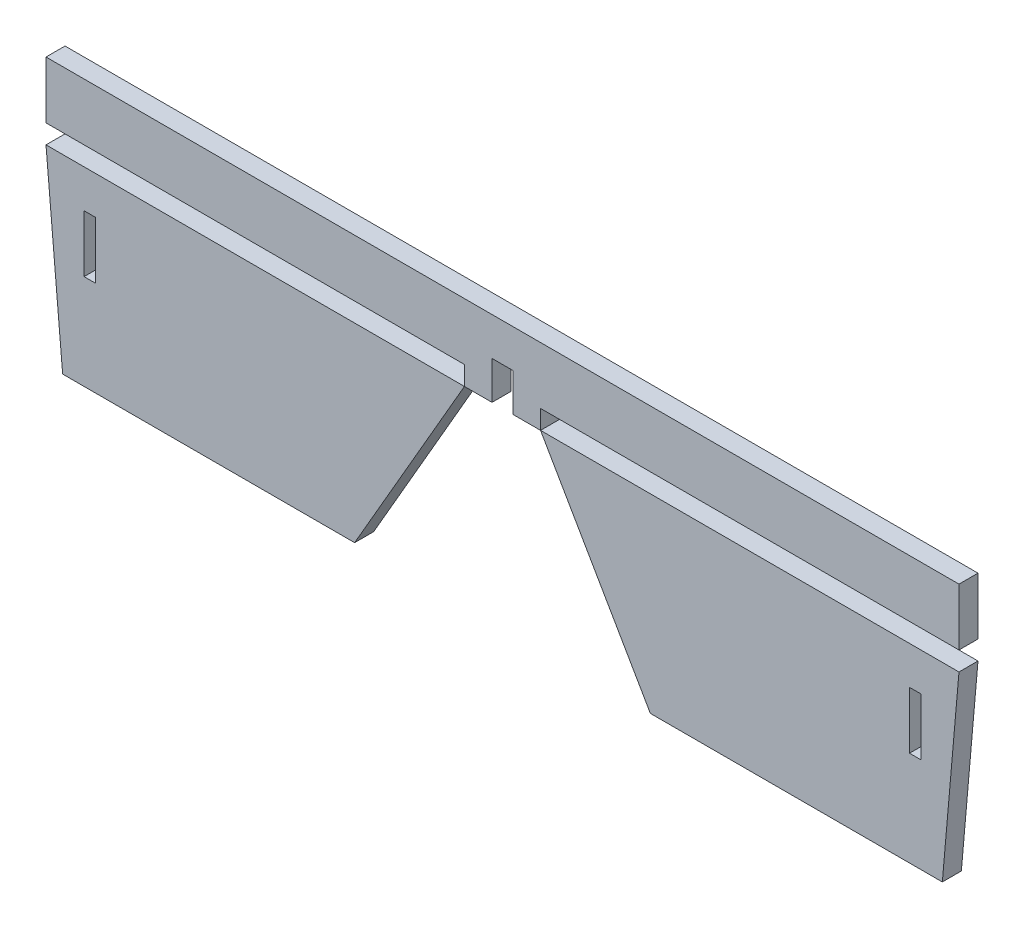
from build123d import *

# Parameters (mm, degrees)
SKETCH1_W             = 3
SKETCH1_H             = 15
BOSS_EXTRUDE2_DEPTH   = 2.5
BOSS_EXTRUDE2_2_DEPTH = 2.5
MIRROR1_START         = -5
MIRROR1_OUTLINE_W     = 117.25
MIRROR1_OUTLINE_H     = 5
MIRROR1_DEPTH         = 15
MIRROR1_START_2       = -10
MIRROR1_2_OUTLINE_W   = 7.25
MIRROR1_2_OUTLINE_H   = 5
MIRROR1_2_DEPTH       = 5
MIRROR1_3_OUTLINE_W   = 2.75
MIRROR1_3_OUTLINE_H   = 5
MIRROR1_3_DEPTH       = 10


# Read off the part's stored shape, not the designer's step: Mirror1
with BuildPart() as part:
    # Sketch1 → Boss-Extrude2 (new, symmetric)
    with BuildSketch(Plane.XY):
        Polygon((-10, -10), (-120, -10), (-115.625566824, -60), (-38.867513459, -60), align=None)
        with Locations((-108.5, -27.5)):
            Rectangle(SKETCH1_W, SKETCH1_H, mode=Mode.SUBTRACT)
    extrude(amount=BOSS_EXTRUDE2_DEPTH, both=True)


with BuildPart() as body_2:
    # Sketch1 → Boss-Extrude2 2 (new, symmetric)
    with BuildSketch(Plane.XY):
        Polygon((-120, 10), (-120, -5), (-10, -5), (-10, -10), (-2.75, -10), (-2.75, 0), (0, 0), (0, 10), align=None)
    extrude(amount=BOSS_EXTRUDE2_2_DEPTH, both=True)



with BuildPart() as body_3:
    # Mirror1 outline → Mirror1 (new body)
    with BuildSketch(Plane(origin=(0, 0, 0), x_dir=(1, 0, 0), z_dir=(0, 1, 0)).offset(MIRROR1_START)):
        with Locations((61.375, 0)):
            Rectangle(MIRROR1_OUTLINE_W, MIRROR1_OUTLINE_H)
    extrude(amount=MIRROR1_DEPTH)

    # Mirror1 2 outline → Mirror1 2 (add)
    with BuildSketch(Plane(origin=(0, 0, 0), x_dir=(1, 0, 0), z_dir=(0, 1, 0)).offset(MIRROR1_START_2)):
        with Locations((6.375, 0)):
            Rectangle(MIRROR1_2_OUTLINE_W, MIRROR1_2_OUTLINE_H)
    extrude(amount=MIRROR1_2_DEPTH)


with BuildPart() as body_2_1:
    add(body_2.part)

    add(body_3.part)  # Mirror1 3 merges body 3
    # Mirror1 3 outline → Mirror1 3 (add)
    with BuildSketch(Plane(origin=(0, 0, 0), x_dir=(1, 0, 0), z_dir=(0, 1, 0))):
        with Locations((1.375, 0)):
            Rectangle(MIRROR1_3_OUTLINE_W, MIRROR1_3_OUTLINE_H)
    extrude(amount=MIRROR1_3_DEPTH)


with BuildPart() as body_3_2:
    # Mirror2: mirrored copy
    add(part.part.mirror(Plane(origin=(0, 0, 0), x_dir=(0, 0, 1), z_dir=(1, 0, 0))))


solid = Compound([part.part, body_2_1.part, body_3_2.part])
